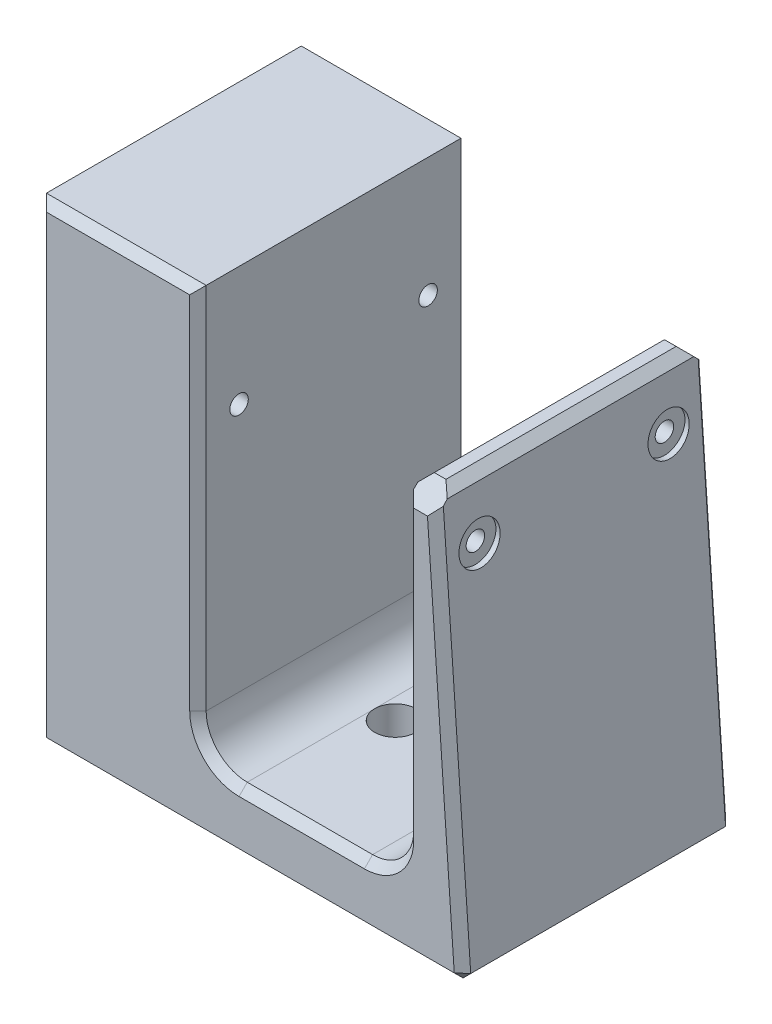
from build123d import *
from OCP.BRepFilletAPI import BRepFilletAPI_MakeChamfer

# Parameters (mm, degrees)
ESTRUSIONE_ESTRUSIONE1_DEPTH                         = 66
RACCORDO1_R                                          = 10
SMUSSO1_SIZE                                         = 2
SMUSSO1_SIZE2                                        = 2.155800013
SMUSSO1_SIZE2_2                                      = 1.873732722
SMUSSO2_SIZE                                         = 5
FORO_LAMATO_PER_VITE_M4_A_TESTA_CILINDRI_D           = 4.5
FORO_LAMATO_PER_VITE_M4_A_TESTA_CILINDRI_DEPTH       = 30
FORO_LAMATO_PER_VITE_M4_A_TESTA_CILINDRI_CBORE_D     = 10
FORO_LAMATO_PER_VITE_M4_A_TESTA_CILINDRI_CBORE_DEPTH = 3
FORO_LAMATO_PER_VITE_M4_A_TESTA_CILINDRI_TIP         = 1.351936393
FORO_LAMATO_PER_VITE_M4_A_TESTA_CILI_2_D             = 4.5
FORO_LAMATO_PER_VITE_M4_A_TESTA_CILI_2_DEPTH         = 30
FORO_LAMATO_PER_VITE_M4_A_TESTA_CILI_2_CBORE_D       = 10
FORO_LAMATO_PER_VITE_M4_A_TESTA_CILI_2_CBORE_DEPTH   = 10
FORO_LAMATO_PER_VITE_M4_A_TESTA_CILI_2_TIP           = 1.351936393
FORO_LAMATO_PER_VITE_M4_A_TESTA_CILI_3_D             = 4.5
FORO_LAMATO_PER_VITE_M4_A_TESTA_CILI_3_DEPTH         = 45
FORO_LAMATO_PER_VITE_M4_A_TESTA_CILI_3_CBORE_D       = 10
FORO_LAMATO_PER_VITE_M4_A_TESTA_CILI_3_CBORE_DEPTH   = 32
FORO_LAMATO_PER_VITE_M4_A_TESTA_CILI_3_TIP           = 1.351936393


with BuildPart() as part:
    # Schizzo1 → Estrusione-Estrusione1 (new body)
    with BuildSketch(Plane.XY):
        Polygon((25.25, 100), (32.25, 100), (39.25, 0), (-39.25, 0), (-64.110342, 0), (-64.110342, 114.69), (-25.25, 114.69), (-25.25, 100), (-25.25, 15), (25.25, 15), align=None)
    extrude(amount=ESTRUSIONE_ESTRUSIONE1_DEPTH)

    # Raccordo1
    raccordo1_edges = [part.edges().sort_by_distance(p)[0] for p in [
        (-25.25, 15, 33),
        (25.25, 15, 33),
    ]]
    fillet(raccordo1_edges, radius=RACCORDO1_R)

    # Smusso1: one chamfer whose edges measure the first distance from different faces: ONE call of the kernel's chamfer builder (chamfer() names one face for all edges)
    smusso1_edges_1 = [part.edges().sort_by_distance(p)[0] for p in [
        (35.75, 50, 0),
        (-12.430171, 0, 0),
        (-64.110342, 57.345, 0),
        (-44.680171, 114.69, 0),
        (25.25, 62.5, 0),
        (25.25, 100, 33),
        (-44.680171, 114.69, 66),
        (-64.110342, 57.345, 66),
        (-12.430171, 0, 66),
        (-25.25, 69.845, 0),
        (-25.25, 69.845, 66),
        (0, 15, 0),
        (0, 15, 66),
        (-22.321067812, 17.928932188, 0),
        (-22.321067812, 17.928932188, 66),
        (35.75, 50, 66),
        (22.321067812, 17.928932188, 0),
        (22.321067812, 17.928932188, 66),
        (25.25, 62.5, 66),
    ]]
    smusso1_edges_2 = [part.edges().sort_by_distance(p)[0] for p in [
        (32.25, 100, 33),
    ]]
    smusso1_side_2 = [part.faces().sort_by_distance(p)[0] for p in [
        (35.75, 50, 33),
    ]]
    smusso1_edges_3 = [part.edges().sort_by_distance(p)[0] for p in [
        (39.25, 0, 33),
    ]]
    smusso1_side_3 = [part.faces().sort_by_distance(p)[0] for p in [
        (-12.430171, 0, 33),
    ]]
    smusso1 = BRepFilletAPI_MakeChamfer(part.part.solid().wrapped)
    for e in smusso1_edges_1:
        smusso1.Add(SMUSSO1_SIZE, e.wrapped)
    for e in smusso1_edges_2:
        smusso1.Add(SMUSSO1_SIZE, SMUSSO1_SIZE2, e.wrapped, smusso1_side_2[0].wrapped)  # the first distance lies on this face
    for e in smusso1_edges_3:
        smusso1.Add(SMUSSO1_SIZE, SMUSSO1_SIZE2_2, e.wrapped, smusso1_side_3[0].wrapped)  # the first distance lies on this face
    add(Compound.cast(smusso1.Shape()), mode=Mode.REPLACE)

    # Smusso2
    # the kernel refuses this chamfer: 5 mm, written as the material it takes off along each edge
    with BuildSketch(Plane(origin=(14.39158506, 100, 66), x_dir=(2.02935454733688e-15, -0.9996219169112968, 0.027495876610587663), z_dir=(1, 0, 0)), Plane(origin=(14.39158506, 100, 0), x_dir=(0, 0.0274958766105877, 0.9996219169112968), z_dir=(1, 0, 0))) as smusso2_piece_1:
        Polygon((SMUSSO2_SIZE * 0.999621916911, SMUSSO2_SIZE * 0.0274958766106), (-SMUSSO2_SIZE * 0.0274958766106, SMUSSO2_SIZE * 0.999621916911), (0, 0), align=None)
    extrude(amount=28.561029867, mode=Mode.SUBTRACT)

    # Foro lamato per Vite M4 a testa cilindri
    with Locations(Plane(origin=(35.25, 0, 0), x_dir=(0, 0, 1), z_dir=(1, 0, 0))):
        with Locations((56, -85.613628), (10, -85.613628)):
            CounterBoreHole(FORO_LAMATO_PER_VITE_M4_A_TESTA_CILINDRI_D / 2, FORO_LAMATO_PER_VITE_M4_A_TESTA_CILINDRI_CBORE_D / 2, FORO_LAMATO_PER_VITE_M4_A_TESTA_CILINDRI_CBORE_DEPTH, depth=FORO_LAMATO_PER_VITE_M4_A_TESTA_CILINDRI_DEPTH)
            with Locations((0, 0, -(FORO_LAMATO_PER_VITE_M4_A_TESTA_CILINDRI_DEPTH + FORO_LAMATO_PER_VITE_M4_A_TESTA_CILINDRI_TIP / 2))):  # 118° drill point
                Cone(0, FORO_LAMATO_PER_VITE_M4_A_TESTA_CILINDRI_D / 2, FORO_LAMATO_PER_VITE_M4_A_TESTA_CILINDRI_TIP, mode=Mode.SUBTRACT)

    # Foro lamato per Vite M4 a testa cili 2
    with Locations(Plane(origin=(0, 15, 0), x_dir=(1, 0, 0), z_dir=(0, 1, 0))):
        with Locations((-10.245584981, -33), (9.754415019, -33)):
            CounterBoreHole(FORO_LAMATO_PER_VITE_M4_A_TESTA_CILI_2_D / 2, FORO_LAMATO_PER_VITE_M4_A_TESTA_CILI_2_CBORE_D / 2, FORO_LAMATO_PER_VITE_M4_A_TESTA_CILI_2_CBORE_DEPTH, depth=FORO_LAMATO_PER_VITE_M4_A_TESTA_CILI_2_DEPTH)
            with Locations((0, 0, -(FORO_LAMATO_PER_VITE_M4_A_TESTA_CILI_2_DEPTH + FORO_LAMATO_PER_VITE_M4_A_TESTA_CILI_2_TIP / 2))):  # 118° drill point
                Cone(0, FORO_LAMATO_PER_VITE_M4_A_TESTA_CILI_2_D / 2, FORO_LAMATO_PER_VITE_M4_A_TESTA_CILI_2_TIP, mode=Mode.SUBTRACT)

    # Foro lamato per Vite M4 a testa cili 3
    with Locations(Plane.ZY.offset(64.110342)):
        with Locations((10, 85.613628), (56, 85.613628)):
            CounterBoreHole(FORO_LAMATO_PER_VITE_M4_A_TESTA_CILI_3_D / 2, FORO_LAMATO_PER_VITE_M4_A_TESTA_CILI_3_CBORE_D / 2, FORO_LAMATO_PER_VITE_M4_A_TESTA_CILI_3_CBORE_DEPTH, depth=FORO_LAMATO_PER_VITE_M4_A_TESTA_CILI_3_DEPTH)
            with Locations((0, 0, -(FORO_LAMATO_PER_VITE_M4_A_TESTA_CILI_3_DEPTH + FORO_LAMATO_PER_VITE_M4_A_TESTA_CILI_3_TIP / 2))):  # 118° drill point
                Cone(0, FORO_LAMATO_PER_VITE_M4_A_TESTA_CILI_3_D / 2, FORO_LAMATO_PER_VITE_M4_A_TESTA_CILI_3_TIP, mode=Mode.SUBTRACT)


solid = part.part
